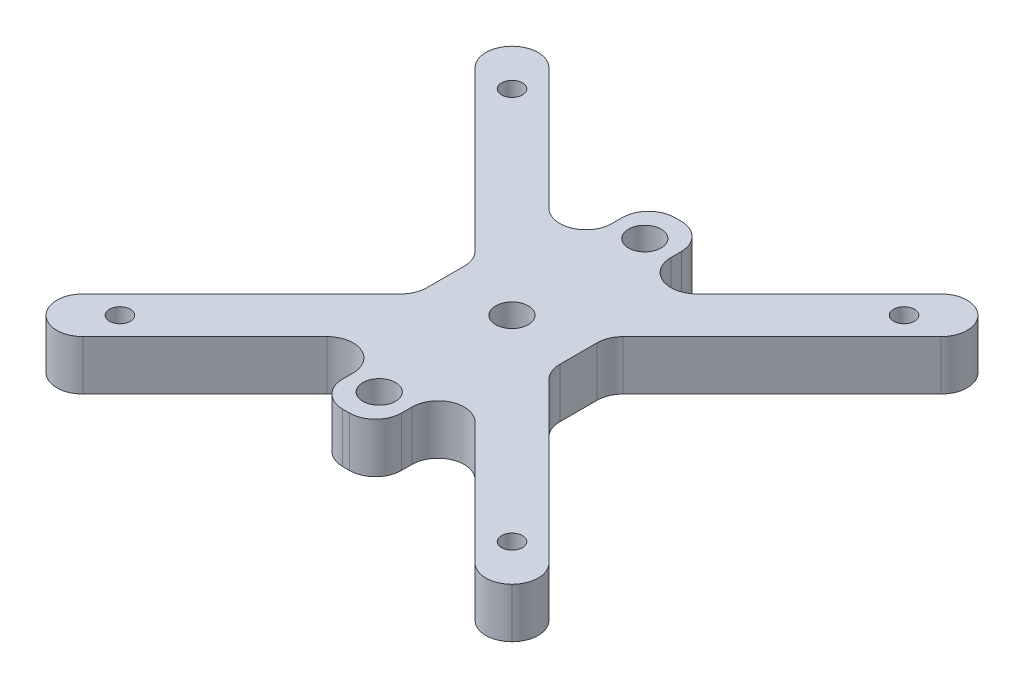
from build123d import *

# Parameters (mm, degrees)
SKETCH1_R           = 2
SKETCH1_R_2         = 3.125
BOSS_EXTRUDE1_DEPTH = 9.525
FILLET1_R           = 5


with BuildPart() as part:
    # Sketch1 → Boss-Extrude1 (new body)
    with BuildSketch(Plane(origin=(0, 0, 0), x_dir=(1, 0, 0), z_dir=(0, 1, 0))):
        Polygon((-12.7, 5.628932188), (-48.106601718, 41.035533906), (-41.035533906, 48.106601718), (-5.628932188, 12.7), (-5.628932188, 31.75), (5.628932188, 31.75), (5.628932188, 12.7), (41.035533906, 48.106601718), (48.106601718, 41.035533906), (12.7, 5.628932188), (12.7, -5.628932188), (48.106601718, -41.035533906), (41.035533906, -48.106601718), (5.628932188, -12.7), (5.628932188, -31.75), (-5.628932188, -31.75), (-5.628932188, -12.7), (-41.035533906, -48.106601718), (-48.106601718, -41.035533906), (-12.7, -5.628932188), align=None)
        with Locations(Location((37.5, 37.5, 0), (0, 0, 90))):
            Circle(SKETCH1_R, mode=Mode.SUBTRACT)
        with Locations(Location((37.5, -37.5, 0), (0, 0, 90))):
            Circle(SKETCH1_R, mode=Mode.SUBTRACT)
        with Locations(Location((-37.5, -37.5, 0), (0, 0, 90))):
            Circle(SKETCH1_R, mode=Mode.SUBTRACT)
        with Locations(Location((-37.5, 37.5, 0), (0, 0, 90))):
            Circle(SKETCH1_R, mode=Mode.SUBTRACT)
        with Locations(Location((0, 0, 0), (0, 0, 90))):
            Circle(SKETCH1_R_2, mode=Mode.SUBTRACT)
        with Locations(Location((0, 25.4, 0), (0, 0, 90))):
            Circle(SKETCH1_R_2, mode=Mode.SUBTRACT)
        with Locations(Location((0, -25.4, 0), (0, 0, 90))):
            Circle(SKETCH1_R_2, mode=Mode.SUBTRACT)
    extrude(amount=BOSS_EXTRUDE1_DEPTH)

    # Fillet1
    fillet1_edges = [part.edges().sort_by_distance(p)[0] for p in [
        (12.7, 4.7625, -5.628932188),
        (12.7, 4.7625, 5.628932188),
        (48.106601718, 4.7625, 41.035533906),
        (41.035533906, 4.7625, 48.106601718),
        (-41.035533906, 4.7625, 48.106601718),
        (-48.106601718, 4.7625, 41.035533906),
        (-12.7, 4.7625, 5.628932188),
        (-48.106601718, 4.7625, -41.035533906),
        (-41.035533906, 4.7625, -48.106601718),
        (41.035533906, 4.7625, -48.106601718),
        (48.106601718, 4.7625, -41.035533906),
        (-12.7, 4.7625, -5.628932188),
        (-5.628932188, 4.7625, 31.75),
        (-5.628932188, 4.7625, 12.7),
        (5.628932188, 4.7625, 12.7),
        (5.628932188, 4.7625, -12.7),
        (5.628932188, 4.7625, -31.75),
        (-5.628932188, 4.7625, -31.75),
        (-5.628932188, 4.7625, -12.7),
        (5.628932188, 4.7625, 31.75),
    ]]
    fillet(fillet1_edges, radius=FILLET1_R - 0.0001)  # a hair under: the kernel refuses the full size


solid = part.part
